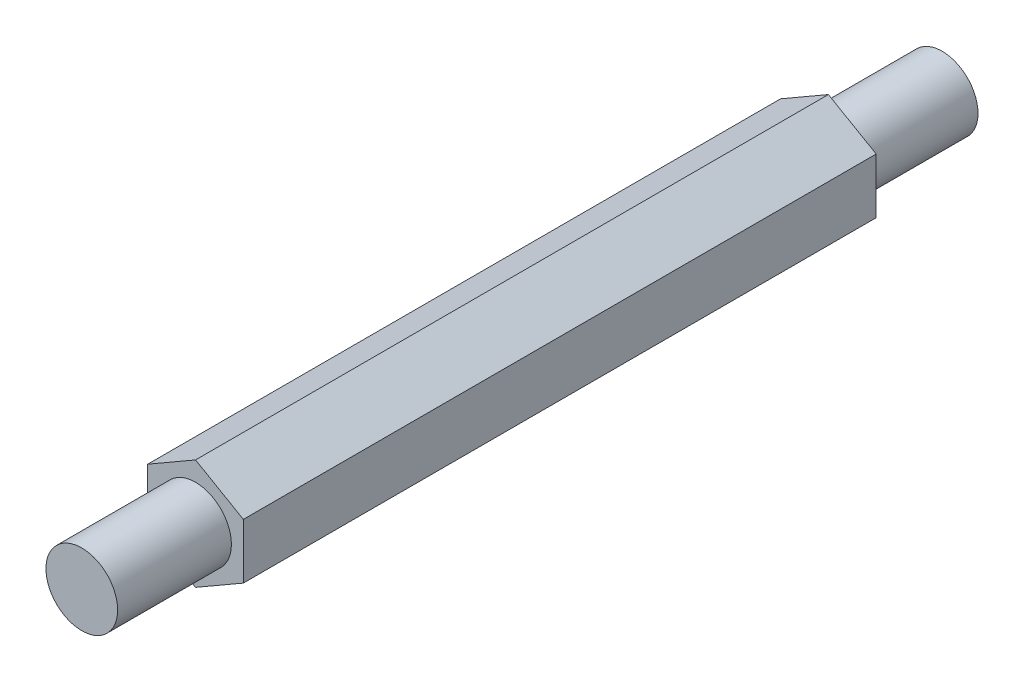
from build123d import *

# Parameters (mm, degrees)
BOSS_EXTRUDE1_DEPTH = 84.074
SKETCH1_3_R         = 9.525
BOSS_EXTRUDE2_DEPTH = 114.3


with BuildPart() as part:
    # Sketch1 → Boss-Extrude1 (new, symmetric)
    with BuildSketch(Plane.XY):
        Polygon((-12.7, -7.332348419), (0, -14.664696837), (12.7, -7.332348419), (12.7, 7.332348419), (0, 14.664696837), (-12.7, 7.332348419), align=None)
    extrude(amount=BOSS_EXTRUDE1_DEPTH, both=True)

    # Sketch1<3> → Boss-Extrude2 (add, symmetric)
    with BuildSketch(Plane.XY):
        Circle(SKETCH1_3_R)
    extrude(amount=BOSS_EXTRUDE2_DEPTH, both=True)


solid = part.part
